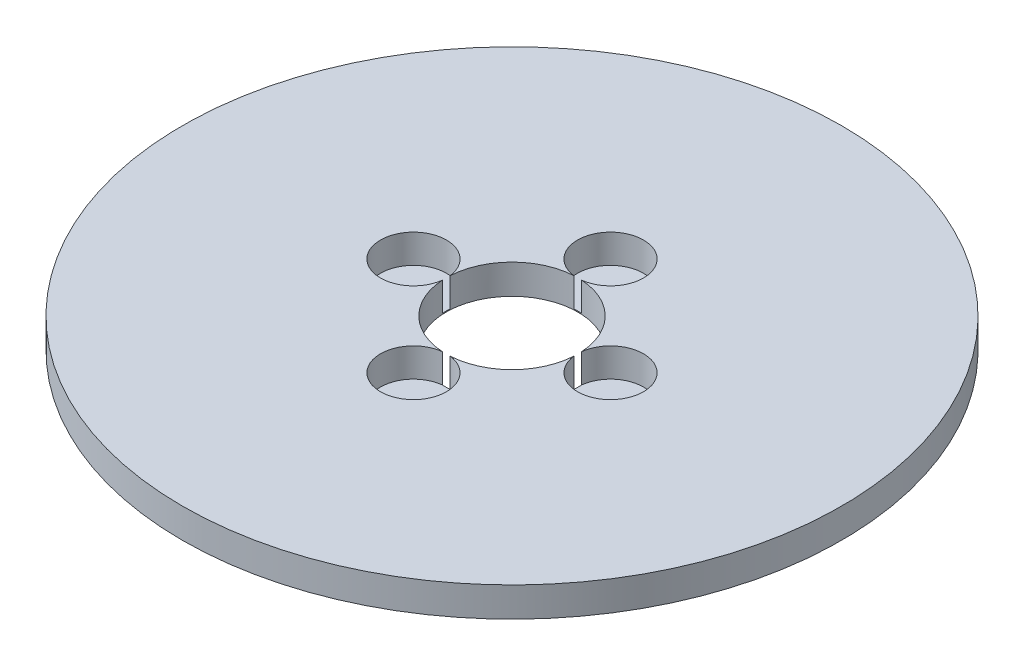
from build123d import *

# Parameters (mm, degrees)
SKETCH1_R           = 100
BOSS_EXTRUDE1_DEPTH = 9
SKETCH2_R           = 20
CUT_EXTRUDE1_DEPTH  = 142.707445111
SKETCH3_R           = 10
CUT_EXTRUDE2_DEPTH  = 8.744862256
CIRPATTERN1_COUNT   = 4


with BuildPart() as part:
    # Sketch1 → Boss-Extrude1 (new body)
    with BuildSketch(Plane(origin=(0, 0, 0), x_dir=(1, 0, 0), z_dir=(0, 1, 0))):
        Circle(SKETCH1_R)
    extrude(amount=BOSS_EXTRUDE1_DEPTH)

    # Sketch2 → Cut-Extrude1 (cut, through all)
    with BuildSketch(Plane(origin=(0, 0, 0), x_dir=(1, 0, 0), z_dir=(0, 1, 0))):
        Circle(SKETCH2_R)
    extrude(amount=CUT_EXTRUDE1_DEPTH, mode=Mode.SUBTRACT)

    # Sketch3 → Cut-Extrude2 (cut)
    with BuildSketch(Plane(origin=(0, 9, 0), x_dir=(1, 0, 0), z_dir=(0, 1, 0))):
        with Locations((-29.895247837, 0)):
            Circle(SKETCH3_R)
    cut_extrude2 = extrude(amount=-CUT_EXTRUDE2_DEPTH, mode=Mode.SUBTRACT)

    # CirPattern1: Cut-Extrude2 ×4 about axis
    cirpattern1_axis = Axis((0, 0, 0), (0, 1, 0))
    for i in range(1, CIRPATTERN1_COUNT):
        add(cut_extrude2.rotate(cirpattern1_axis, i * 360 / CIRPATTERN1_COUNT), mode=Mode.SUBTRACT)


solid = part.part
